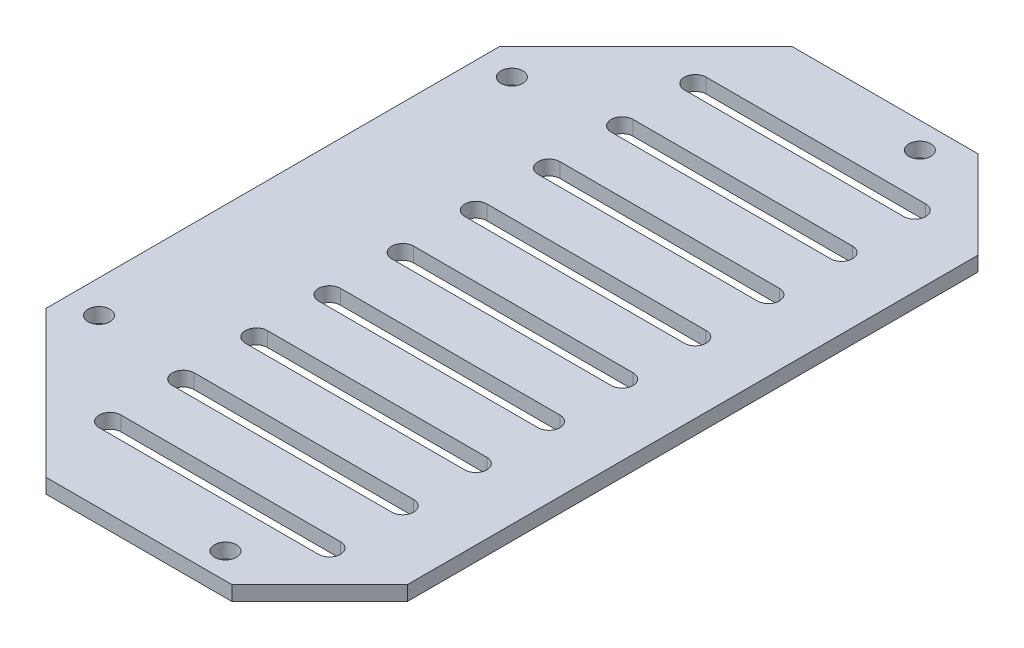
from build123d import *

# Parameters (mm, degrees)
BOSS_EXTRUDE1_DEPTH = 2
CHAMFER1_SIZE       = 12
SKETCH2_R           = 1.5
CUT_EXTRUDE1_DEPTH  = 10


with BuildPart() as part:
    # Sketch1 → Boss-Extrude1 (new body)
    with BuildSketch(Plane(origin=(0, 0, 0), x_dir=(1, 0, 0), z_dir=(0, 1, 0))):
        Polygon((-25.833763343, 95.703211573), (11.576236657, 95.703211573), (11.576236657, -6.301788427), (-25.833763343, -6.301788427), (-45.833763343, 13.698211573), (-45.833763343, 75.703211573), align=None)
        with BuildLine():
            Line((1.925471464, 43.200711573), (-28.074528536, 43.200711573))
            ThreePointArc((-28.074528536, 43.200711573), (-29.574528536, 44.700711573), (-28.074528536, 46.200711573))
            Line((-28.074528536, 46.200711573), (1.925471464, 46.200711573))
            ThreePointArc((1.925471464, 46.200711573), (3.425471464, 44.700711573), (1.925471464, 43.200711573))
        make_face(mode=Mode.SUBTRACT)
        with BuildLine():
            Line((1.925471464, 53.200711573), (-28.074528536, 53.200711573))
            ThreePointArc((-28.074528536, 53.200711573), (-29.574528536, 54.700711573), (-28.074528536, 56.200711573))
            Line((-28.074528536, 56.200711573), (1.925471464, 56.200711573))
            ThreePointArc((1.925471464, 56.200711573), (3.425471464, 54.700711573), (1.925471464, 53.200711573))
        make_face(mode=Mode.SUBTRACT)
        with BuildLine():
            Line((1.925471464, 63.200711573), (-28.074528536, 63.200711573))
            ThreePointArc((-28.074528536, 63.200711573), (-29.574528536, 64.700711573), (-28.074528536, 66.200711573))
            Line((-28.074528536, 66.200711573), (1.925471464, 66.200711573))
            ThreePointArc((1.925471464, 66.200711573), (3.425471464, 64.700711573), (1.925471464, 63.200711573))
        make_face(mode=Mode.SUBTRACT)
        with BuildLine():
            Line((1.925471464, 73.200711573), (-28.074528536, 73.200711573))
            ThreePointArc((-28.074528536, 73.200711573), (-29.574528536, 74.700711573), (-28.074528536, 76.200711573))
            Line((-28.074528536, 76.200711573), (1.925471464, 76.200711573))
            ThreePointArc((1.925471464, 76.200711573), (3.425471464, 74.700711573), (1.925471464, 73.200711573))
        make_face(mode=Mode.SUBTRACT)
        with BuildLine():
            Line((1.925471464, 83.200711573), (-28.074528536, 83.200711573))
            ThreePointArc((-28.074528536, 83.200711573), (-29.574528536, 84.700711573), (-28.074528536, 86.200711573))
            Line((-28.074528536, 86.200711573), (1.925471464, 86.200711573))
            ThreePointArc((1.925471464, 86.200711573), (3.425471464, 84.700711573), (1.925471464, 83.200711573))
        make_face(mode=Mode.SUBTRACT)
        with BuildLine():
            Line((1.925471464, 36.200711573), (-28.074528536, 36.200711573))
            ThreePointArc((-28.074528536, 36.200711573), (-29.574528536, 34.700711573), (-28.074528536, 33.200711573))
            Line((-28.074528536, 33.200711573), (1.925471464, 33.200711573))
            ThreePointArc((1.925471464, 33.200711573), (3.425471464, 34.700711573), (1.925471464, 36.200711573))
        make_face(mode=Mode.SUBTRACT)
        with BuildLine():
            Line((1.925471464, 26.200711573), (-28.074528536, 26.200711573))
            ThreePointArc((-28.074528536, 26.200711573), (-29.574528536, 24.700711573), (-28.074528536, 23.200711573))
            Line((-28.074528536, 23.200711573), (1.925471464, 23.200711573))
            ThreePointArc((1.925471464, 23.200711573), (3.425471464, 24.700711573), (1.925471464, 26.200711573))
        make_face(mode=Mode.SUBTRACT)
        with BuildLine():
            Line((1.925471464, 16.200711573), (-28.074528536, 16.200711573))
            ThreePointArc((-28.074528536, 16.200711573), (-29.574528536, 14.700711573), (-28.074528536, 13.200711573))
            Line((-28.074528536, 13.200711573), (1.925471464, 13.200711573))
            ThreePointArc((1.925471464, 13.200711573), (3.425471464, 14.700711573), (1.925471464, 16.200711573))
        make_face(mode=Mode.SUBTRACT)
        with BuildLine():
            Line((1.925471464, 6.200711573), (-28.074528536, 6.200711573))
            ThreePointArc((-28.074528536, 6.200711573), (-29.574528536, 4.700711573), (-28.074528536, 3.200711573))
            Line((-28.074528536, 3.200711573), (1.925471464, 3.200711573))
            ThreePointArc((1.925471464, 3.200711573), (3.425471464, 4.700711573), (1.925471464, 6.200711573))
        make_face(mode=Mode.SUBTRACT)
    extrude(amount=BOSS_EXTRUDE1_DEPTH)

    # Chamfer1
    chamfer1_edges = [part.edges().sort_by_distance(p)[0] for p in [
        (11.576236657, 1, 6.301788427),
        (11.576236657, 1, -95.703211573),
    ]]
    chamfer(chamfer1_edges, length=CHAMFER1_SIZE)

    # Sketch2 → Cut-Extrude1 (cut)
    with BuildSketch(Plane(origin=(0, 2, 0), x_dir=(1, 0, 0), z_dir=(0, 1, 0))):
        with Locations((-4.838827122, 92.166588575)):
            Circle(SKETCH2_R)
        with Locations((-41.371381926, 72.921675145)):
            Circle(SKETCH2_R)
        with Locations((-41.371381926, 16.479748001)):
            Circle(SKETCH2_R)
        with Locations((-4.838827122, -2.765165428)):
            Circle(SKETCH2_R)
    extrude(amount=-CUT_EXTRUDE1_DEPTH, mode=Mode.SUBTRACT)


solid = part.part
